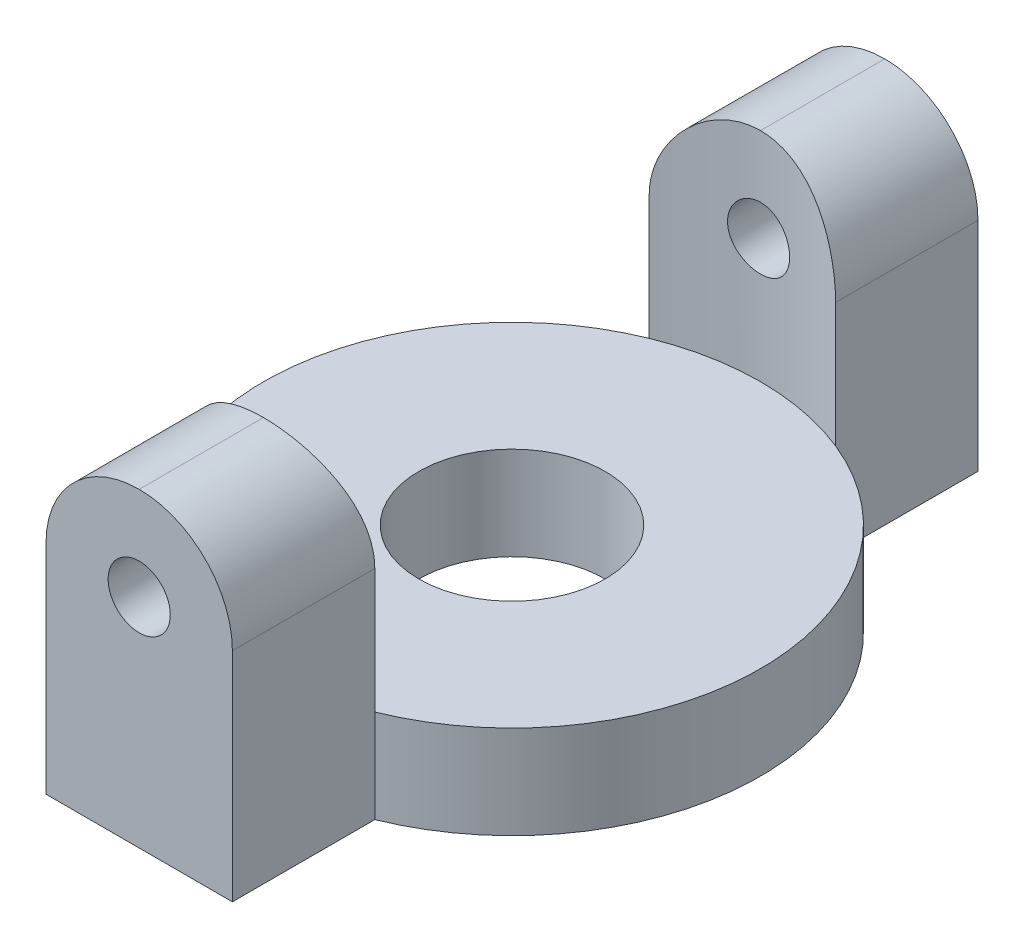
from build123d import *

# Parameters (mm, degrees)
SKETCH1_R           = 4
SKETCH1_R_2         = 1.5
BOSS_EXTRUDE1_DEPTH = 1.5
BOSS_EXTRUDE2_DEPTH = 5
SKETCH4_R           = 0.5
CUT_EXTRUDE1_DEPTH  = 14.601470509
FILLET1_R           = 1.5


with BuildPart() as part:
    # Sketch1 → Boss-Extrude1 (new body)
    with BuildSketch(Plane(origin=(0, 0, 0), x_dir=(1, 0, 0), z_dir=(0, 1, 0))):
        with Locations(Location((0, 0, 0), (0, 0, 270))):
            Circle(SKETCH1_R)
        with Locations(Location((0, 0, 0), (0, 0, 270))):
            Circle(SKETCH1_R_2, mode=Mode.SUBTRACT)
    extrude(amount=BOSS_EXTRUDE1_DEPTH)

    # Sketch3 → Boss-Extrude2 (add)
    with BuildSketch(Plane(origin=(0, 0, 0), x_dir=(1, 0, 0), z_dir=(0, 1, 0))):
        with BuildLine():
            Line((-1.5, -3.708099244), (-1.5, -6))
            Line((-1.5, -6), (1.5, -6))
            Line((1.5, -6), (1.5, -3.708099244))
            ThreePointArc((1.5, -3.708099244), (0, -4), (-1.5, -3.708099244))
        make_face()
        with BuildLine():
            Line((-1.5, 6), (1.5, 6))
            Line((1.5, 6), (1.5, 3.708099244))
            ThreePointArc((1.5, 3.708099244), (0, 4), (-1.5, 3.708099244))
            Line((-1.5, 3.708099244), (-1.5, 6))
        make_face()
    extrude(amount=BOSS_EXTRUDE2_DEPTH)

    # Sketch4 → Cut-Extrude1 (cut, through all)
    with BuildSketch(Plane.XY.offset(6)):
        with Locations((0, 3.5)):
            Circle(SKETCH4_R)
    extrude(amount=-CUT_EXTRUDE1_DEPTH, mode=Mode.SUBTRACT)

    # Fillet1
    fillet1_edges = [part.edges().sort_by_distance(p)[0] for p in [
        (1.5, 5, 4.854049622),
        (-1.5, 5, 4.854049622),
        (1.5, 5, -4.854049622),
        (-1.5, 5, -4.854049622),
    ]]
    fillet(fillet1_edges, radius=FILLET1_R - 0.0001)  # a hair under: the kernel refuses the full size


solid = part.part
